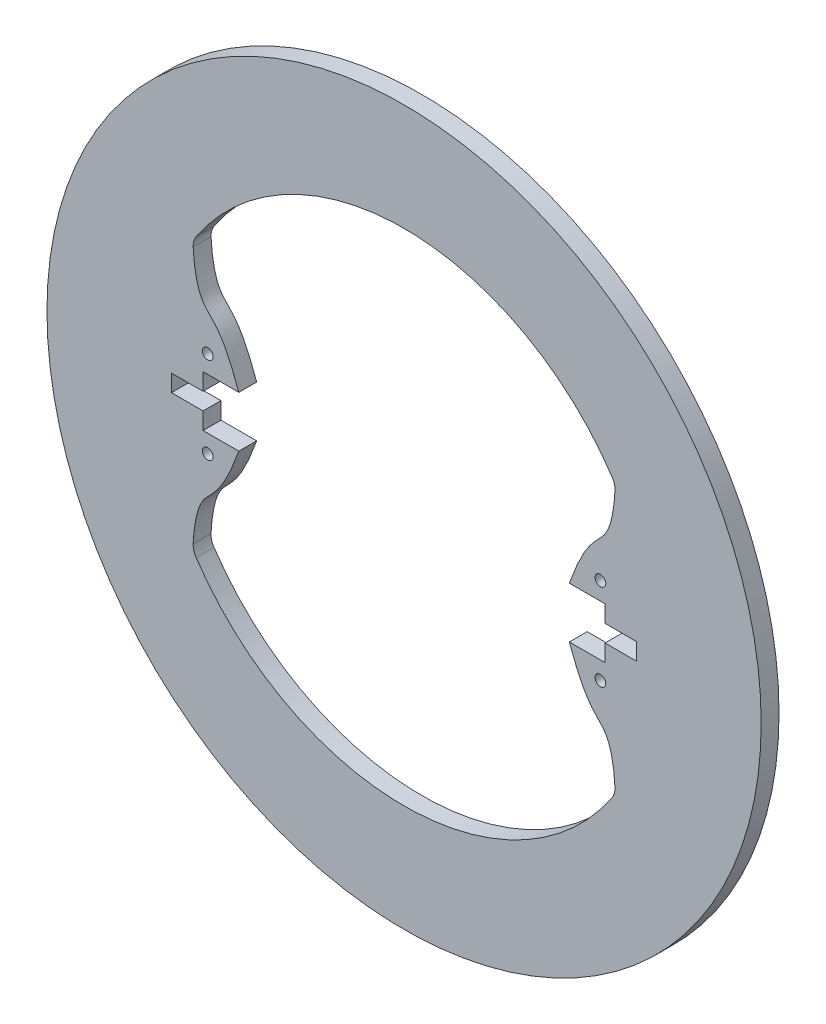
from build123d import *

# Parameters (mm, degrees)
BOSS_EXTRUDE1_OUTLINE_R = 99.95
BOSS_EXTRUDE1_DEPTH     = 5
SKETCH12_R              = 1.5
CUT_EXTRUDE1_DEPTH      = 142.439050622


# Read off the part's stored shape, not the designer's step: Boss-Extrude1
with BuildPart() as part:
    # Boss-Extrude1 outline → Boss-Extrude1 (new body)
    with BuildSketch(Plane.XY):
        Circle(BOSS_EXTRUDE1_OUTLINE_R)
        with BuildLine():
            Line((-65.1, 2.375), (-56.25, 2.375))
            Line((-56.25, 2.375), (-56.25, 7.125))
            Line((-56.25, 7.125), (-46.25, 7.125))
            add(Edge.make_bspline(
                [(-59.02632848, 35.967099571), (-58.7951175, 29.14610967), (-56.28933902, 16.934975154), (-53.993681028, 28.823744698), (-46.25, 7.125)],
                knots=[0, 0, 0, 0, 0, 1, 1, 1, 1, 1], degree=4))
            ThreePointArc((-59.02632848, 35.967099571), (-58.837492639, 37.507730313), (-58.185290714, 38.916216986))
            ThreePointArc((-58.185290714, 38.916216986), (0, 70), (58.185290714, 38.916216986))
            ThreePointArc((58.185290714, 38.916216986), (58.837492639, 37.507730313), (59.02632848, 35.967099571))
            add(Edge.make_bspline(
                [(46.25, 7.125), (53.993681028, 28.823744698), (56.28933902, 16.934975154), (58.7951175, 29.14610967), (59.02632848, 35.967099571)],
                knots=[0, 0, 0, 0, 0, 1, 1, 1, 1, 1], degree=4))
            Line((46.25, 7.125), (56.25, 7.125))
            Line((56.25, 7.125), (56.25, 2.375))
            Line((56.25, 2.375), (65.1, 2.375))
            Line((65.1, 2.375), (65.1, -2.375))
            Line((65.1, -2.375), (56.25, -2.375))
            Line((56.25, -2.375), (56.25, -7.125))
            Line((56.25, -7.125), (46.25, -7.125))
            add(Edge.make_bspline(
                [(59.02632848, -35.967099571), (58.7951175, -29.14610967), (56.28933902, -16.934975154), (53.993681028, -28.823744698), (46.25, -7.125)],
                knots=[0, 0, 0, 0, 0, 1, 1, 1, 1, 1], degree=4))
            ThreePointArc((59.02632848, -35.967099571), (58.837492639, -37.507730313), (58.185290714, -38.916216986))
            ThreePointArc((58.185290714, -38.916216986), (0, -70), (-58.185290714, -38.916216986))
            ThreePointArc((-58.185290714, -38.916216986), (-58.837492639, -37.507730313), (-59.02632848, -35.967099571))
            add(Edge.make_bspline(
                [(-46.25, -7.125), (-53.993681028, -28.823744698), (-56.28933902, -16.934975154), (-58.7951175, -29.14610967), (-59.02632848, -35.967099571)],
                knots=[0, 0, 0, 0, 0, 1, 1, 1, 1, 1], degree=4))
            Line((-46.25, -7.125), (-56.25, -7.125))
            Line((-56.25, -7.125), (-56.25, -2.375))
            Line((-56.25, -2.375), (-65.1, -2.375))
            Line((-65.1, -2.375), (-65.1, 2.375))
        make_face(mode=Mode.SUBTRACT)
    extrude(amount=BOSS_EXTRUDE1_DEPTH)

    # Sketch12 → Cut-Extrude1 (cut, through all)
    with BuildSketch(Plane.XY.offset(5)):
        with Locations((-54.951905284, 12.125)):
            Circle(SKETCH12_R)
        with Locations(Location((54.951905284, 12.125, 0), (0, 0, 180))):
            Circle(SKETCH12_R)
        with Locations((54.951905284, -12.125)):
            Circle(SKETCH12_R)
        with Locations(Location((-54.951905284, -12.125, 0), (0, 0, 180))):
            Circle(SKETCH12_R)
    extrude(amount=-CUT_EXTRUDE1_DEPTH, mode=Mode.SUBTRACT)


solid = part.part
